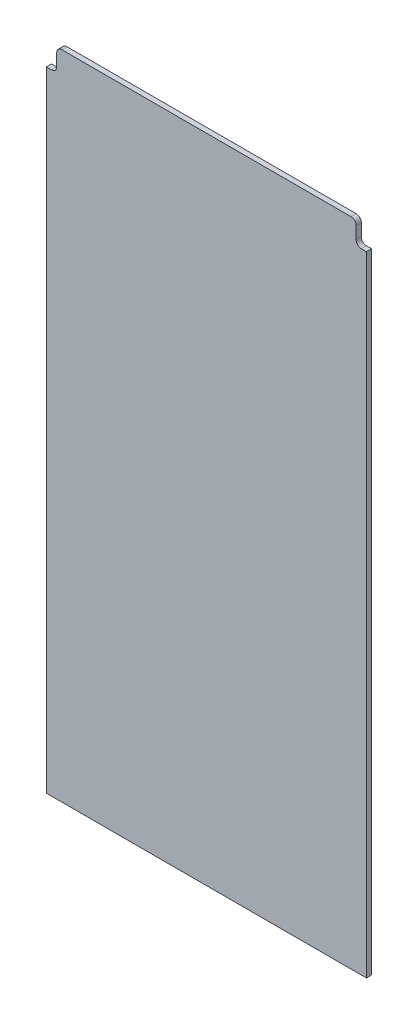
from build123d import *

# Parameters (mm, degrees)
SKETCH1_W           = 197.5866
SKETCH1_H           = 402.272499995
BOSS_EXTRUDE1_DEPTH = 3.175
SKETCH3_W           = 6.35
SKETCH3_H           = 13.97
CUT_EXTRUDE1_DEPTH  = 459.355390558
FILLET1_R           = 3.175


with BuildPart() as part:
    # Sketch1 → Boss-Extrude1 (new body)
    with BuildSketch(Plane.XY):
        with Locations((182.40375, -160.813750003)):
            Rectangle(SKETCH1_W, SKETCH1_H)
    extrude(amount=BOSS_EXTRUDE1_DEPTH)

    # Sketch3 → Cut-Extrude1 (cut, through all)
    with BuildSketch(Plane.XY.offset(3.175)):
        with Locations((86.78545, 33.337499995)):
            Rectangle(SKETCH3_W, SKETCH3_H)
        with Locations((278.02205, 33.337499995)):
            Rectangle(SKETCH3_W, SKETCH3_H)
    extrude(amount=-CUT_EXTRUDE1_DEPTH, mode=Mode.SUBTRACT)

    # Fillet1
    fillet1_edges = [part.edges().sort_by_distance(p)[0] for p in [
        (89.96045, 26.352499995, 1.5875),
        (89.96045, 40.322499995, 1.5875),
        (274.84705, 40.322499995, 1.5875),
        (274.84705, 26.352499995, 1.5875),
    ]]
    fillet(fillet1_edges, radius=FILLET1_R)


solid = part.part
